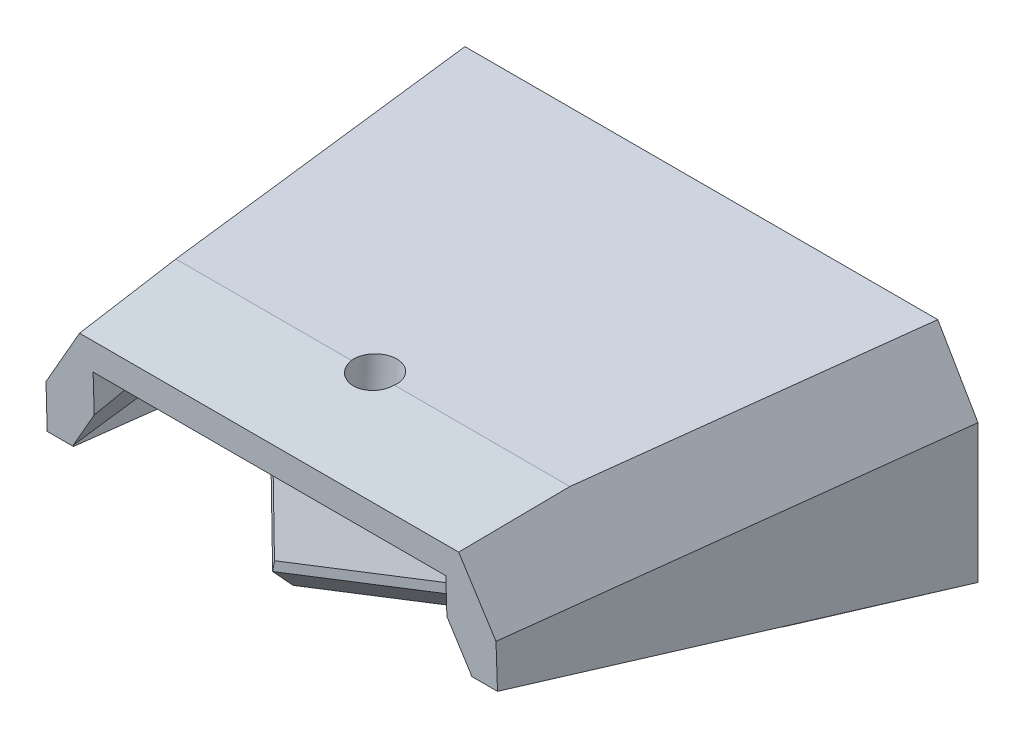
from build123d import *
from OCP.BRepFilletAPI import BRepFilletAPI_MakeChamfer

# Parameters (mm, degrees)
EXTRUDE_3_DEPTH                  = 3
EXTRUDE_4_DEPTH                  = 12.5
CHAMFER_3_SIZE                   = 2
CHAMFER_3_SIZE2                  = 3.464101615
CHAMFER_4_SIZE                   = 4
CHAMFER_4_SIZE2                  = 2.309401077
CUT_EXTRUDE_2_DEPTH              = 41.277164746
CUT_EXTRUDE_2_DEPTH_BACK         = 41.277164746
EXTRUDE_5_DEPTH                  = 1.5
CUT_EXTRUDE_5_DEPTH              = 1.5
CHAMFER_7_SIZE                   = 1.5
CHAMFER_7_SIZE_2                 = 1.539926414
CHAMFER_8_SIZE                   = 2.598076211
CHAMFER_8_SIZE_2                 = 1.5
CHAMFER_10_SIZE                  = 1
CUT_EXTRUDE_START                = 2.76887
CUT_EXTRUDE_13_DEPTH             = 20.4
SKETCH_16_R                      = 1.25
CUT_EXTRUDE_14_DEPTH             = 10
CUT_EXTRUDE_15_REACH             = 54.631
CUT_EXTRUDE_START_2              = 13
CUT_EXTRUDE_15_DIRECTION_2_REACH = 54.631
CUT_EXTRUDE_START_3              = -5
CUT_EXTRUDE_16_DEPTH             = 45.631175115


# Some blends are built 0.0001 mm under size
with BuildPart() as part:
    # Эскиз5 → Бобышка-Вытянуть3 (new body)
    with BuildSketch(Plane(origin=(0, 0, 0), x_dir=(1, 0, 0), z_dir=(0, 1, 0))):
        Polygon((0, 0), (26, 0), (29, 25), (13, 25), (-3, 25), align=None)
    extrude(amount=EXTRUDE_3_DEPTH)

    # Эскиз6 → Бобышка-Вытянуть4 (add)
    with BuildSketch(Plane(origin=(0, 0, 0), x_dir=(-1, 0, 0), z_dir=(0, -1, 0))):
        Polygon((0, 0), (3, 25), (1.483218869, 25), (-1.516781131, 0), align=None)
        Polygon((-27.483218869, 25), (-29, 25), (-26, 0), (-24.483218869, 0), align=None)
    extrude(amount=EXTRUDE_4_DEPTH)

    # Фаска3
    chamfer_3_edges = [part.edges().sort_by_distance(p)[0] for p in [
        (0.016781131, 0, -12.5),
        (25.983218869, 0, -12.5),
    ]]
    chamfer_3_side = [part.faces().sort_by_distance(p)[0] for p in [
        (13, 0, -12.981390637),
    ]]
    chamfer(chamfer_3_edges, length=CHAMFER_3_SIZE, length2=CHAMFER_3_SIZE2, reference=chamfer_3_side[0])

    # Фаска4: one chamfer whose edges measure the first distance from different faces: ONE call of the kernel's chamfer builder (chamfer() names one face for all edges)
    chamfer_4_edges_1 = [part.edges().sort_by_distance(p)[0] for p in [
        (27.5, 3, -12.5),
    ]]
    chamfer_4_side_1 = [part.faces().sort_by_distance(p)[0] for p in [
        (27.5, -4.75, -12.5),
    ]]
    chamfer_4_edges_2 = [part.edges().sort_by_distance(p)[0] for p in [
        (-1.5, 3, -12.5),
    ]]
    chamfer_4_side_2 = [part.faces().sort_by_distance(p)[0] for p in [
        (-1.5, -4.75, -12.5),
    ]]
    chamfer_4 = BRepFilletAPI_MakeChamfer(part.part.solid().wrapped)
    for e in chamfer_4_edges_1:
        chamfer_4.Add(CHAMFER_4_SIZE, CHAMFER_4_SIZE2, e.wrapped, chamfer_4_side_1[0].wrapped)  # the first distance lies on this face
    for e in chamfer_4_edges_2:
        chamfer_4.Add(CHAMFER_4_SIZE, CHAMFER_4_SIZE2, e.wrapped, chamfer_4_side_2[0].wrapped)  # the first distance lies on this face
    add(Compound.cast(chamfer_4.Shape()), mode=Mode.REPLACE)

    # Эскиз7 → Вырез-Вытянуть2 (cut, two sides: drawn at the far end of the back side and taken through both)
    with BuildSketch(Plane(origin=(0, 0, 0), x_dir=(0, 0, -1), z_dir=(1, 0, 0)).offset(-CUT_EXTRUDE_2_DEPTH_BACK)):
        Polygon((25, -14), (25, -9), (0, -3.5), (0, -11), (0, -14), align=None)
    extrude(amount=CUT_EXTRUDE_2_DEPTH + CUT_EXTRUDE_2_DEPTH_BACK, mode=Mode.SUBTRACT)

    # Эскиз8 → Бобышка-Вытянуть5 (add)
    with BuildSketch(Plane(origin=(0, -3.33842045, 0.734452499), x_dir=(-1, 0, 0), z_dir=(0, -0.97664446670509, 0.2148617826751198))):
        Polygon((-29, 26.349867712), (3, 26.349867712), (0, 0.214861783), (-26, 0.214861783), align=None)
    extrude(amount=EXTRUDE_5_DEPTH)

    # Эскиз12 → Вырез-Вытянуть5 (cut)
    with BuildSketch(Plane(origin=(0, -4.80338715, 1.056745173), x_dir=(-1, 0, 0), z_dir=(0, -0.9766444667050901, 0.21486178267511977))):
        Polygon((-27.335370868, 26.349867712), (-13, 11.718369714), (1.483218869, 26.349867712), align=None)
        Polygon((-26, 0.214861783), (-13, 0.214861783), (-13, 1.069133834), (-27.836275269, 16.211883463), (-27.726463854, 15.255242802), align=None)
        Polygon((-13, 1.069133834), (-13, 0.214861783), (0, 0.214861783), (1.726463854, 15.255242802), (1.81620359, 16.037025649), align=None)
    extrude(amount=-CUT_EXTRUDE_5_DEPTH, mode=Mode.SUBTRACT)

    # Фаска7
    # the kernel refuses this chamfer: 1.539926414, 1.5 mm, written as the material it adds along each edge
    with BuildSketch(Plane(origin=(25.624388162, -5.592143703, -9.509744106), x_dir=(0.053421240321816, 0.9765759265760705, -0.20843615500811763), z_dir=(0.11640066814175269, -0.21340122492654667, -0.9700055678479392))) as chamfer_7_piece_1_section:
        Polygon((CHAMFER_7_SIZE * 0.99960211638, -CHAMFER_7_SIZE * 0.0282065405255), (-CHAMFER_7_SIZE_2 * 0.0537868652542, -CHAMFER_7_SIZE_2 * 0.998552439015), (0, 0), align=None)
    chamfer_7_piece_1 = extrude(amount=19.932121115, mode=Mode.PRIVATE)
    chamfer_7_piece_1 = split(chamfer_7_piece_1, bisect_by=Plane(origin=(26.215798587, -7.11837448, -25), z_dir=(0, 0, 1)), keep=Keep.TOP, mode=Mode.PRIVATE)
    chamfer_7_piece_1 = split(chamfer_7_piece_1, bisect_by=Plane(origin=(28.863675649, -6.560961429, -16.229864216), z_dir=(-0.7142981809435934, -0.1503691897591953, -0.6834963170872516)), keep=Keep.TOP, mode=Mode.PRIVATE)
    chamfer_7_piece_1 = split(chamfer_7_piece_1, bisect_by=Plane(origin=(23.540170532, -7.681629481, -21.323809907), z_dir=(0.7142981809435934, 0.15036918975919533, 0.6834963170872517)), keep=Keep.TOP, mode=Mode.PRIVATE)
    add(chamfer_7_piece_1)

    # Фаска8
    chamfer_8_edges_1 = [part.edges().sort_by_distance(p)[0] for p in [
        (-2.408101795, -9.357048885, -19.641717258),
    ]]
    chamfer_8_side_1 = [part.faces().sort_by_distance(p)[0] for p in [
        (-2.378297509, -9.357783968, -19.645058546),
    ]]
    chamfer_8_edges_2 = [part.edges().sort_by_distance(p)[0] for p in [
        (28.418137634, -9.375834016, -19.727104216),
    ]]
    chamfer_8_side_2 = [part.faces().sort_by_distance(p)[0] for p in [
        (28.388333349, -9.376569099, -19.730445503),
    ]]
    chamfer_8 = BRepFilletAPI_MakeChamfer(part.part.solid().wrapped)
    for e in chamfer_8_edges_1:
        chamfer_8.Add(CHAMFER_8_SIZE - 0.0001, CHAMFER_8_SIZE_2 - 0.0001, e.wrapped, chamfer_8_side_1[0].wrapped)
    for e in chamfer_8_edges_2:
        chamfer_8.Add(CHAMFER_8_SIZE - 0.0001, CHAMFER_8_SIZE_2 - 0.0001, e.wrapped, chamfer_8_side_2[0].wrapped)
    add(Compound.cast(chamfer_8.Shape()), mode=Mode.REPLACE)  # a hair under: the kernel refuses the full size

    # Фаска10
    chamfer_10_edges = [part.edges().sort_by_distance(p)[0] for p in [
        (7.070930475, -6.320076094, -5.837295478),
        (18.937101702, -6.335110761, -5.905634875),
    ]]
    chamfer(chamfer_10_edges, length=CHAMFER_10_SIZE)

    # Эскиз15 → Вырез-Вытянуть13 (cut)
    with BuildSketch(Plane(origin=(0, 0, 0), x_dir=(0, 0, -1), z_dir=(1, 0, 0)).offset(CUT_EXTRUDE_START)):
        Polygon((-0.003394727, -2.1), (12.496605273, -2.1), (12.496605273, 0), (-0.003394727, 0.9), align=None)
    extrude(amount=CUT_EXTRUDE_13_DEPTH, mode=Mode.SUBTRACT)

    # Эскиз16 → Вырез-Вытянуть14 (cut)
    with BuildSketch(Plane(origin=(0, 0.891145714, -0.119581473), x_dir=(-1, 0, 0), z_dir=(0, -0.9974180343569141, 0.0718140984736978))):
        with Locations(Location((-13, 5.84494773, 0), (0, 0, 90))):
            Circle(SKETCH_16_R)
    extrude(amount=-CUT_EXTRUDE_14_DEPTH, mode=Mode.SUBTRACT)

    # Вырез-Вытянуть15: up to this plane
    cut_extrude_15_end = Plane(origin=(1.516781131, -3.464101615, 0), z_dir=(0.8598565649588564, -0.4999999999999951, -0.10318278779506272))
    # Эскиз17 → Вырез-Вытянуть15 (cut, up to the surface)
    with BuildSketch(Plane(origin=(0, 0, 0), x_dir=(0, 0, -1), z_dir=(1, 0, 0)).offset(CUT_EXTRUDE_START_2), mode=Mode.PRIVATE) as cut_extrude_15_sk1:
        Polygon((25, 1.5), (8.333333333, 0), (8.333333333, -2.621768853), (25, -2.621768853), align=None)
    cut_extrude_15_tool1 = split(extrude(cut_extrude_15_sk1.sketch, amount=-CUT_EXTRUDE_15_REACH, mode=Mode.PRIVATE), bisect_by=cut_extrude_15_end, keep=Keep.BOTH, mode=Mode.PRIVATE)
    add(cut_extrude_15_tool1.solids().sort_by_distance((13, -0.90808, -17.284542))[0], mode=Mode.SUBTRACT)

    # Вырез-Вытянуть15 direction 2: up to this plane
    cut_extrude_15_direction_2_end = Plane(origin=(24.483218869, -3.464101615, 0), z_dir=(-0.859856564958857, -0.49999999999999406, -0.10318278779506279))
    # Эскиз17 → Вырез-Вытянуть15 direction 2 (cut, up to the surface)
    with BuildSketch(Plane(origin=(0, 0, 0), x_dir=(0, 0, -1), z_dir=(1, 0, 0)).offset(CUT_EXTRUDE_START_2), mode=Mode.PRIVATE) as cut_extrude_15_direction_2_sk1:
        Polygon((25, 1.5), (8.333333333, 0), (8.333333333, -2.621768853), (25, -2.621768853), align=None)
    cut_extrude_15_direction_2_tool1 = split(extrude(cut_extrude_15_direction_2_sk1.sketch, amount=CUT_EXTRUDE_15_DIRECTION_2_REACH, mode=Mode.PRIVATE), bisect_by=cut_extrude_15_direction_2_end, keep=Keep.BOTH, mode=Mode.PRIVATE)
    add(cut_extrude_15_direction_2_tool1.solids().sort_by_distance((13, -0.90808, -17.284542))[0], mode=Mode.SUBTRACT)

    # Эскиз18 → Вырез-Вытянуть16 (cut, through all)
    with BuildSketch(Plane(origin=(0, 0, 0), x_dir=(0, 0, -1), z_dir=(1, 0, 0)).offset(CUT_EXTRUDE_START_3)):
        Polygon((6, 3), (0, 2.5), (0, 3), align=None)
        Polygon((0.202280253, -4.056458685), (0, 2.5), (0, -4.056458685), align=None)
    extrude(amount=CUT_EXTRUDE_16_DEPTH, mode=Mode.SUBTRACT)


solid = part.part
